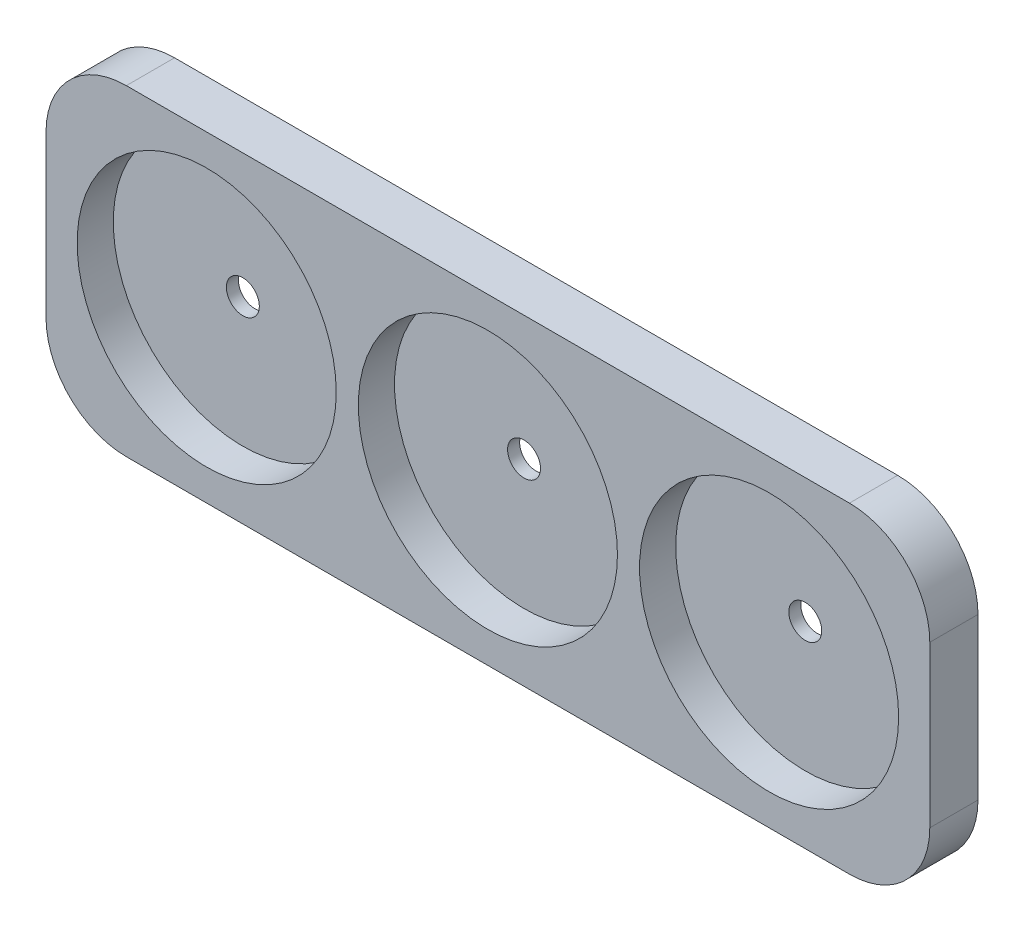
from build123d import *

# Parameters (mm, degrees)
SKETCH1_W           = 110
SKETCH1_H           = 40
BOSS_EXTRUDE1_DEPTH = 6
SKETCH2_R           = 16.125
CUT_EXTRUDE1_DEPTH  = 4.5
FILLET1_R           = 10
SKETCH3_R           = 2.05
CUT_EXTRUDE2_DEPTH  = 59.69625201


with BuildPart() as part:
    # Sketch1 → Boss-Extrude1 (new body)
    with BuildSketch(Plane.XY):
        Rectangle(SKETCH1_W, SKETCH1_H)
    extrude(amount=BOSS_EXTRUDE1_DEPTH)

    # Sketch2 → Cut-Extrude1 (cut)
    with BuildSketch(Plane.XY.offset(6)):
        Circle(SKETCH2_R)
        with Locations((35, 0)):
            Circle(SKETCH2_R)
        with Locations((-35, 0)):
            Circle(SKETCH2_R)
    extrude(amount=-CUT_EXTRUDE1_DEPTH, mode=Mode.SUBTRACT)

    # Fillet1
    fillet1_edges = [part.edges().sort_by_distance(p)[0] for p in [
        (55, -20, 3),
        (55, 20, 3),
        (-55, 20, 3),
        (-55, -20, 3),
    ]]
    fillet(fillet1_edges, radius=FILLET1_R)

    # Sketch3 → Cut-Extrude2 (cut, through all)
    with BuildSketch(Plane.XY.offset(1.5)):
        Circle(SKETCH3_R)
        with Locations((35, 0)):
            Circle(SKETCH3_R)
        with Locations((-35, 0)):
            Circle(SKETCH3_R)
    extrude(amount=-CUT_EXTRUDE2_DEPTH, mode=Mode.SUBTRACT)


solid = part.part
